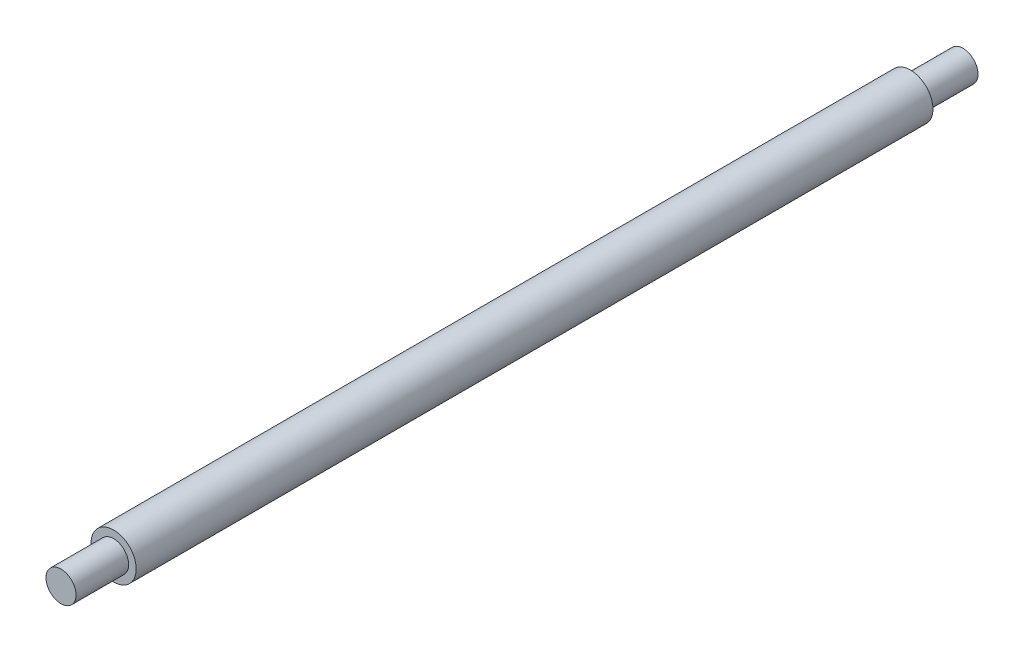
from build123d import *

# Parameters (mm, degrees)
SKETCH1_R           = 9.525
BOSS_EXTRUDE1_DEPTH = 336.55
SKETCH2_R           = 6.35
BOSS_EXTRUDE2_DEPTH = 22.225
BOSS_EXTRUDE3_START = 22.225
SKETCH3_R           = 6.35
BOSS_EXTRUDE3_DEPTH = 22.225


with BuildPart() as part:
    # Sketch1 → Boss-Extrude1 (new body)
    with BuildSketch(Plane.XY):
        Circle(SKETCH1_R)
    extrude(amount=BOSS_EXTRUDE1_DEPTH)

    # Sketch2 → Boss-Extrude2 (add)
    with BuildSketch(Plane.XY.offset(336.55)):
        Circle(SKETCH2_R)
    extrude(amount=BOSS_EXTRUDE2_DEPTH)

    # Sketch3 → Boss-Extrude3 (add)
    with BuildSketch(Plane(origin=(0, 0, 0), x_dir=(-1, 0, 0), z_dir=(0, 0, -1)).offset(BOSS_EXTRUDE3_START)):
        Circle(SKETCH3_R)
    extrude(amount=-BOSS_EXTRUDE3_DEPTH)


solid = part.part
